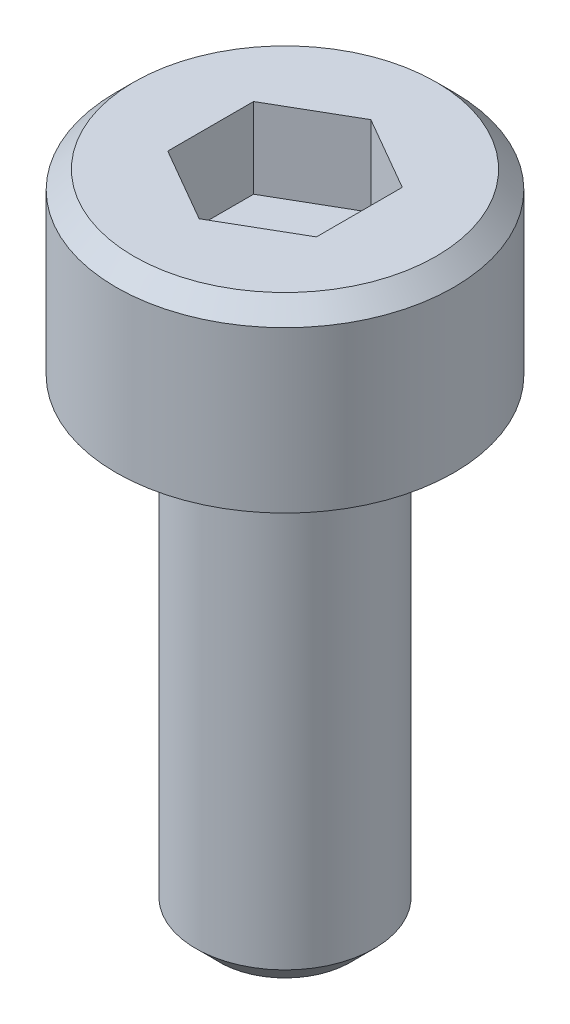
from build123d import *

# Parameters (mm, degrees)
CUT_EXTRUDE1_DEPTH = 1.35


with BuildPart() as part:
    # Sketch1 → Revolve1 (revolve)
    with BuildSketch(Plane.XY):
        Polygon((0, -8), (1.1, -8), (1.5, -7.6), (1.5, 0), (2.84, 0), (2.84, 2.7), (2.54, 3), (0, 3), align=None)
    revolve(axis=Axis((0, -10, 0), (0, 1, 0)))

    # Sketch2 → Cut-Extrude1 (cut)
    with BuildSketch(Plane(origin=(0, 3, 0), x_dir=(1, 0, 0), z_dir=(0, 1, 0))):
        Polygon((1.25, -0.721687836), (0, -1.443375673), (-1.25, -0.721687836), (-1.25, 0.721687836), (0, 1.443375673), (1.25, 0.721687836), align=None)
    extrude(amount=-CUT_EXTRUDE1_DEPTH, mode=Mode.SUBTRACT)


solid = part.part
